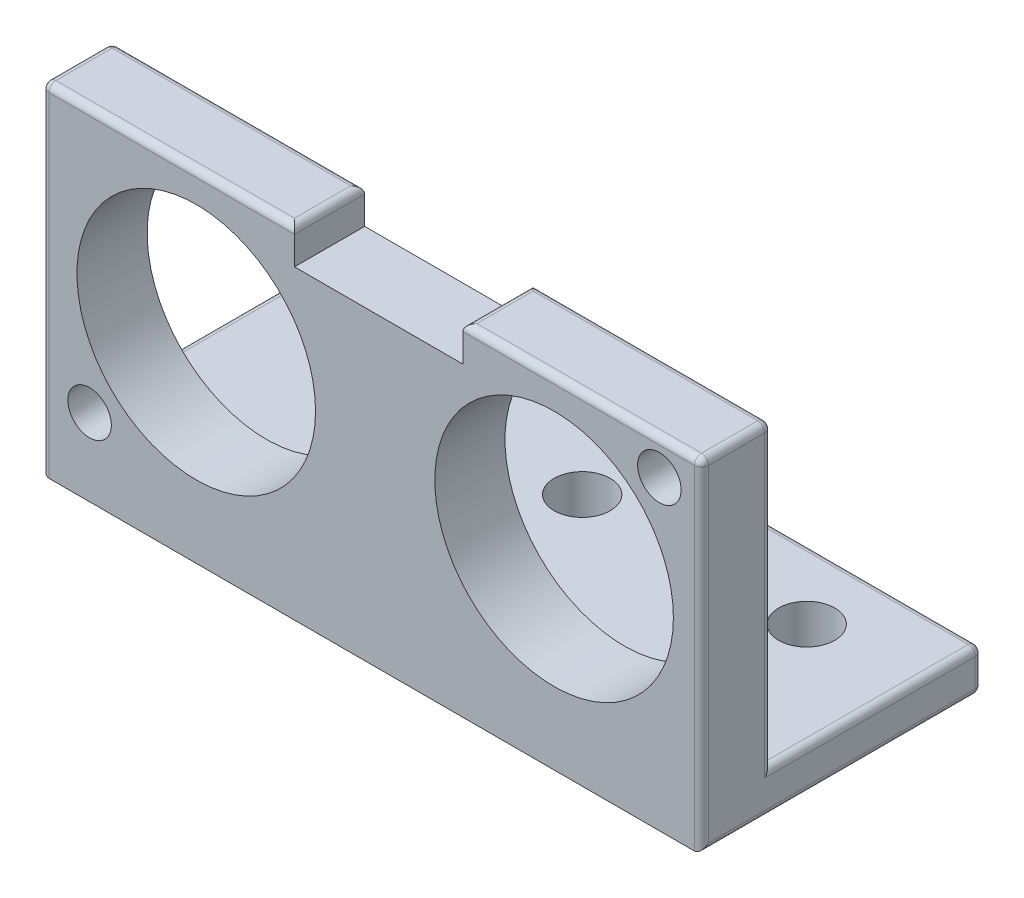
from build123d import *

# Parameters (mm, degrees)
SKETCH_1_W          = 47
SKETCH_1_H          = 21.3
EXTRUDE_1_DEPTH     = 5
SKETCH_2_R          = 1.55
SKETCH_2_R_2        = 8.5
CUT_EXTRUDE_1_DEPTH = 13.95
SKETCH_7_W          = 47
SKETCH_7_H          = 20
EXTRUDE_3_DEPTH     = 3
SKETCH_3_W          = 12
SKETCH_3_H          = 2.5
CUT_EXTRUDE_2_DEPTH = 13.95
FILLET_4_R          = 0.5
SKETCH_11_R         = 2
CUT_EXTRUDE_4_DEPTH = 3
FILLET_5_R          = 0.5


with BuildPart() as part:
    # 草圖1 → 填料-伸長1 (new body)
    with BuildSketch(Plane.XY):
        Rectangle(SKETCH_1_W, SKETCH_1_H)
    extrude(amount=EXTRUDE_1_DEPTH)

    # 草圖2 → 除料-伸長1 (cut)
    with BuildSketch(Plane.XY.offset(5)):
        with Locations((-20.1, -8.15)):
            Circle(SKETCH_2_R)
        with Locations((20.5, 8.15)):
            Circle(SKETCH_2_R)
        with Locations((-12.5, 0)):
            Circle(SKETCH_2_R_2)
        with Locations((13, 0)):
            Circle(SKETCH_2_R_2)
    extrude(amount=-CUT_EXTRUDE_1_DEPTH, mode=Mode.SUBTRACT)

    # 草圖7 → 填料-伸長3 (add)
    with BuildSketch(Plane.XZ.offset(10.65)):
        with Locations((0, -5)):
            Rectangle(SKETCH_7_W, SKETCH_7_H)
    extrude(amount=EXTRUDE_3_DEPTH)

    # 草圖3 → 除料-伸長2 (cut)
    with BuildSketch(Plane.XY.offset(5)):
        with Locations((0.5, 9.4)):
            Rectangle(SKETCH_3_W, SKETCH_3_H)
    extrude(amount=-CUT_EXTRUDE_2_DEPTH, mode=Mode.SUBTRACT)

    # 圓角4
    fillet_4_edges = [part.edges().sort_by_distance(p)[0] for p in [
        (15, 10.65, 5),
        (6.5, 10.65, 2.5),
        (15, 10.65, 0),
        (-14.5, 10.65, 0),
        (-5.5, 10.65, 2.5),
        (-14.5, 10.65, 5),
        (-23.5, 10.65, 2.5),
        (-23.5, -1.5, 5),
        (-23.5, -13.65, -5),
        (-23.5, -12.15, -15),
        (-23.5, -10.65, -7.5),
        (-23.5, 0, 0),
        (23.5, -10.65, -7.5),
        (23.5, -12.15, -15),
        (23.5, -13.65, -5),
        (23.5, -1.5, 5),
        (23.5, 10.65, 2.5),
        (23.5, 0, 0),
    ]]
    fillet(fillet_4_edges, radius=FILLET_4_R)

    # 草圖11 → 除料-伸長4 (cut)
    with BuildSketch(Plane(origin=(0, -10.65, 0), x_dir=(1, 0, 0), z_dir=(0, 1, 0))):
        with Locations(Location((0, 10, 0), (0, 0, 270))):
            Circle(SKETCH_11_R)
        with Locations(Location((16, 10, 0), (0, 0, 270))):
            Circle(SKETCH_11_R)
        with Locations(Location((-16, 10, 0), (0, 0, 270))):
            Circle(SKETCH_11_R)
    extrude(amount=-CUT_EXTRUDE_4_DEPTH, mode=Mode.SUBTRACT)

    # 圓角5
    # the kernel refuses this fillet: 0.5 mm, written as the material it takes off along each edge
    with BuildSketch(Plane(origin=(-23, -13.15, -14.5), x_dir=(0, 0, -1), z_dir=(0, -1, 0))) as fillet_5_piece_1_section:
        Polygon((0, 0), (FILLET_5_R, 0), (FILLET_5_R, -FILLET_5_R), (0, -FILLET_5_R), align=None)
    fillet_5_piece_1 = extrude(amount=FILLET_5_R, mode=Mode.PRIVATE)
    fillet_5_piece_1 = fillet_5_piece_1 - Plane(origin=(-23, -13.15, -14.5), x_dir=(0.7071067811865475, 0, 0.7071067811865475), z_dir=(0, -1, 0)) * Sphere(FILLET_5_R, mode=Mode.PRIVATE)
    add(fillet_5_piece_1, mode=Mode.SUBTRACT)
    with BuildSketch(Plane(origin=(-23, -11.15, -14.5), x_dir=(0, 0, -1), z_dir=(0, 1, 0))) as fillet_5_piece_2_section:
        Polygon((0, 0), (FILLET_5_R, 0), (FILLET_5_R, FILLET_5_R), (0, FILLET_5_R), align=None)
    fillet_5_piece_2 = extrude(amount=FILLET_5_R, mode=Mode.PRIVATE)
    fillet_5_piece_2 = fillet_5_piece_2 - Plane(origin=(-23, -11.15, -14.5), x_dir=(0.7071067811865475, 0, 0.7071067811865475), z_dir=(0, 1, 0)) * Sphere(FILLET_5_R, mode=Mode.PRIVATE)
    add(fillet_5_piece_2, mode=Mode.SUBTRACT)
    with BuildSketch(Plane(origin=(23, -11.15, -14.5), x_dir=(0, 0, -1), z_dir=(0, 1, 0))) as fillet_5_piece_3_section:
        Polygon((0, 0), (FILLET_5_R, 0), (FILLET_5_R, -FILLET_5_R), (0, -FILLET_5_R), align=None)
    fillet_5_piece_3 = extrude(amount=FILLET_5_R, mode=Mode.PRIVATE)
    fillet_5_piece_3 = fillet_5_piece_3 - Plane(origin=(23, -11.15, -14.5), x_dir=(-0.7071067811865475, 0, 0.7071067811865475), z_dir=(0, 1, 0)) * Sphere(FILLET_5_R, mode=Mode.PRIVATE)
    add(fillet_5_piece_3, mode=Mode.SUBTRACT)
    with BuildSketch(Plane(origin=(23, -13.15, -14.5), x_dir=(0, 0, -1), z_dir=(0, -1, 0))) as fillet_5_piece_4_section:
        Polygon((0, 0), (FILLET_5_R, 0), (FILLET_5_R, FILLET_5_R), (0, FILLET_5_R), align=None)
    fillet_5_piece_4 = extrude(amount=FILLET_5_R, mode=Mode.PRIVATE)
    fillet_5_piece_4 = fillet_5_piece_4 - Plane(origin=(23, -13.15, -14.5), x_dir=(-0.7071067811865475, 0, 0.7071067811865475), z_dir=(0, -1, 0)) * Sphere(FILLET_5_R, mode=Mode.PRIVATE)
    add(fillet_5_piece_4, mode=Mode.SUBTRACT)
    with BuildSketch(Plane(origin=(-23, -13.65, -15), x_dir=(0, 0, 1), z_dir=(1, 0, 0))) as fillet_5_piece_5:
        with BuildLine():
            CenterArc((FILLET_5_R, -FILLET_5_R), FILLET_5_R, 90, 90)
            Line((0, -FILLET_5_R), (0, 0))
            Line((0, 0), (FILLET_5_R, 0))
        make_face()
    extrude(amount=46, mode=Mode.SUBTRACT)
    with BuildSketch(Plane(origin=(-23, -10.65, -15), x_dir=(0, 0, 1), z_dir=(1, 0, 0))) as fillet_5_piece_6:
        with BuildLine():
            CenterArc((FILLET_5_R, FILLET_5_R), FILLET_5_R, 180, 90)
            Line((0, FILLET_5_R), (0, 0))
            Line((0, 0), (FILLET_5_R, 0))
        make_face()
    extrude(amount=46, mode=Mode.SUBTRACT)


solid = part.part
